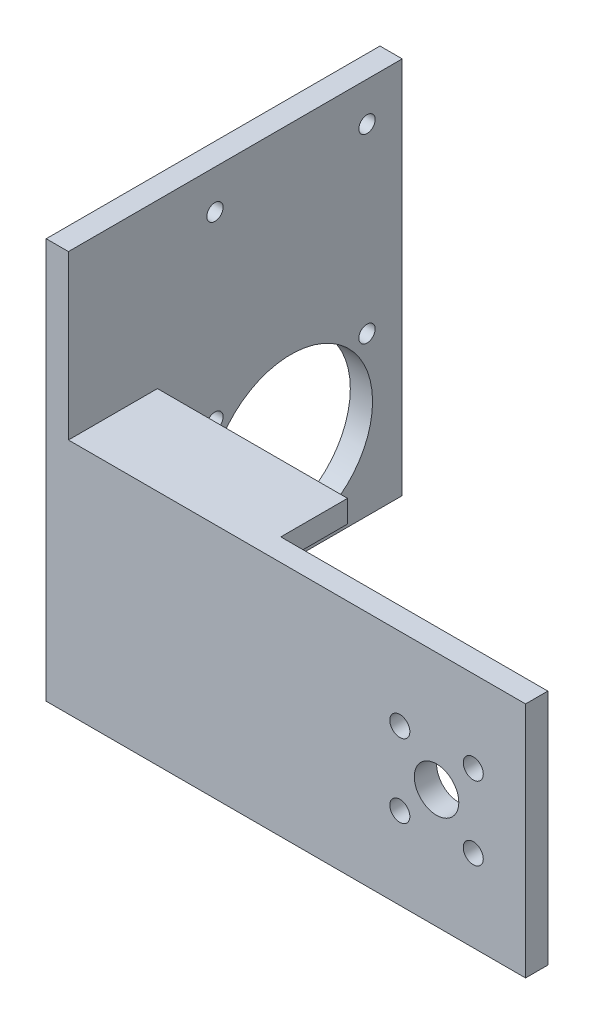
from build123d import *

# Parameters (mm, degrees)
S_BOX1_W      = 64.625
S_BOX1_H      = 32
BOSS_1_DEPTH  = 3
S_BOX2_W      = 3
S_BOX2_H      = 51
BOSS_2_DEPTH  = 45
S_BOX3_W      = 26.125
S_BOX3_H      = 3
BOSS_3_DEPTH  = 11.5
S_BOX4_W      = 26.125
S_BOX4_H      = 3
BOSS_4_DEPTH  = 11.5
S_HOLE5_R     = 3
HOLE_5_DEPTH  = 3.2
S_HOLE6_R     = 1.35
HOLE_6_DEPTH  = 3.2
S_HOLE7_R     = 1.35
HOLE_7_DEPTH  = 3.2
S_HOLE8_R     = 1.35
HOLE_8_DEPTH  = 3.2
S_HOLE9_R     = 1.35
HOLE_9_DEPTH  = 3.2
S_HOLE10_R    = 11
HOLE_10_DEPTH = 3.2
S_HOLE11_R    = 1.1
HOLE_11_DEPTH = 3.2
S_HOLE12_R    = 1.1
HOLE_12_DEPTH = 3.2
S_HOLE13_R    = 1.1
HOLE_13_DEPTH = 3.2
S_HOLE14_R    = 1.1
HOLE_14_DEPTH = 3.2


with BuildPart() as part:
    # S_box1 → Boss_1 (new body)
    with BuildSketch(Plane.XY.offset(27)):
        with Locations((-20.3125, 0)):
            Rectangle(S_BOX1_W, S_BOX1_H)
    extrude(amount=BOSS_1_DEPTH)

    # S_box2 → Boss_2 (add)
    with BuildSketch(Plane.XY.offset(-15)):
        with Locations((-51.125, 12.5)):
            Rectangle(S_BOX2_W, S_BOX2_H)
    extrude(amount=BOSS_2_DEPTH)

    # S_box3 → Boss_3 (add)
    with BuildSketch(Plane.XY.offset(18)):
        with Locations((-37.0625, -12)):
            Rectangle(S_BOX3_W, S_BOX3_H)
    extrude(amount=BOSS_3_DEPTH)

    # S_box4 → Boss_4 (add)
    with BuildSketch(Plane.XY.offset(18)):
        with Locations((-37.0625, 14.5)):
            Rectangle(S_BOX4_W, S_BOX4_H)
    extrude(amount=BOSS_4_DEPTH)

    # S_hole5 → Hole_5 (cut)
    with BuildSketch(Plane.XY.offset(26.9)):
        Circle(S_HOLE5_R)
    extrude(amount=HOLE_5_DEPTH, mode=Mode.SUBTRACT)

    # S_hole6 → Hole_6 (cut)
    with BuildSketch(Plane.XY.offset(26.9)):
        with Locations((4.949747468, -4.949747468)):
            Circle(S_HOLE6_R)
    extrude(amount=HOLE_6_DEPTH, mode=Mode.SUBTRACT)

    # S_hole7 → Hole_7 (cut)
    with BuildSketch(Plane.XY.offset(26.9)):
        with Locations((-4.949747468, -4.949747468)):
            Circle(S_HOLE7_R)
    extrude(amount=HOLE_7_DEPTH, mode=Mode.SUBTRACT)

    # S_hole8 → Hole_8 (cut)
    with BuildSketch(Plane.XY.offset(26.9)):
        with Locations((-4.949747468, 4.949747468)):
            Circle(S_HOLE8_R)
    extrude(amount=HOLE_8_DEPTH, mode=Mode.SUBTRACT)

    # S_hole9 → Hole_9 (cut)
    with BuildSketch(Plane.XY.offset(26.9)):
        with Locations((4.949747468, 4.949747468)):
            Circle(S_HOLE9_R)
    extrude(amount=HOLE_9_DEPTH, mode=Mode.SUBTRACT)

    # S_hole10 → Hole_10 (cut)
    with BuildSketch(Plane(origin=(-52.725, 0, 0), x_dir=(0, 0, -1), z_dir=(1, 0, 0))):
        Circle(S_HOLE10_R)
    extrude(amount=HOLE_10_DEPTH, mode=Mode.SUBTRACT)

    # S_hole11 → Hole_11 (cut)
    with BuildSketch(Plane(origin=(-52.725, 0, 0), x_dir=(0, 0, -1), z_dir=(1, 0, 0))):
        with Locations((10.25, 8.3)):
            Circle(S_HOLE11_R)
    extrude(amount=HOLE_11_DEPTH, mode=Mode.SUBTRACT)

    # S_hole12 → Hole_12 (cut)
    with BuildSketch(Plane(origin=(-52.725, 0, 0), x_dir=(0, 0, -1), z_dir=(1, 0, 0))):
        with Locations((-10.25, 8.3)):
            Circle(S_HOLE12_R)
    extrude(amount=HOLE_12_DEPTH, mode=Mode.SUBTRACT)

    # S_hole13 → Hole_13 (cut)
    with BuildSketch(Plane(origin=(-52.725, 0, 0), x_dir=(0, 0, -1), z_dir=(1, 0, 0))):
        with Locations((10.25, 32.75)):
            Circle(S_HOLE13_R)
    extrude(amount=HOLE_13_DEPTH, mode=Mode.SUBTRACT)

    # S_hole14 → Hole_14 (cut)
    with BuildSketch(Plane(origin=(-52.725, 0, 0), x_dir=(0, 0, -1), z_dir=(1, 0, 0))):
        with Locations((-10.25, 32.75)):
            Circle(S_HOLE14_R)
    extrude(amount=HOLE_14_DEPTH, mode=Mode.SUBTRACT)


solid = part.part
